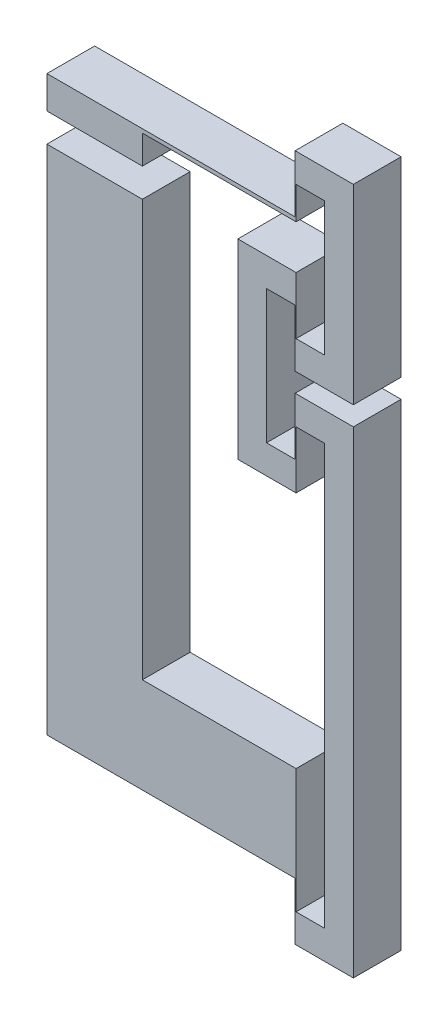
from build123d import *

# Parameters (mm, degrees)
BOSS_EXTRUDE1_DEPTH = 5


with BuildPart() as part:
    # Sketch1 → Boss-Extrude1 (new body)
    with BuildSketch(Plane.XY):
        Polygon((0, 0), (0, 53.6), (10, 53.6), (10, 10), (26.1, 10), (26.1, -3), (29.1, -3), (29.1, 41), (26.1, 41), (26.1, 36), (26.1, 35), (20, 35), (20, 55), (26.1, 55), (26.1, 52), (26.1, 49), (29.1, 49), (29.1, 63), (26.1, 63), (26.1, 60), (26.1, 59.6), (10, 59.6), (10, 56.6), (0, 56.6), (0, 60), (26, 60), (26, 66), (32.1, 66), (32.1, 46), (26, 46), (26, 52), (23, 52), (23, 38), (26, 38), (26, 44), (32.1, 44), (32.1, -6), (26, -6), (26, -3), (26, 0), align=None)
    extrude(amount=BOSS_EXTRUDE1_DEPTH)


solid = part.part
